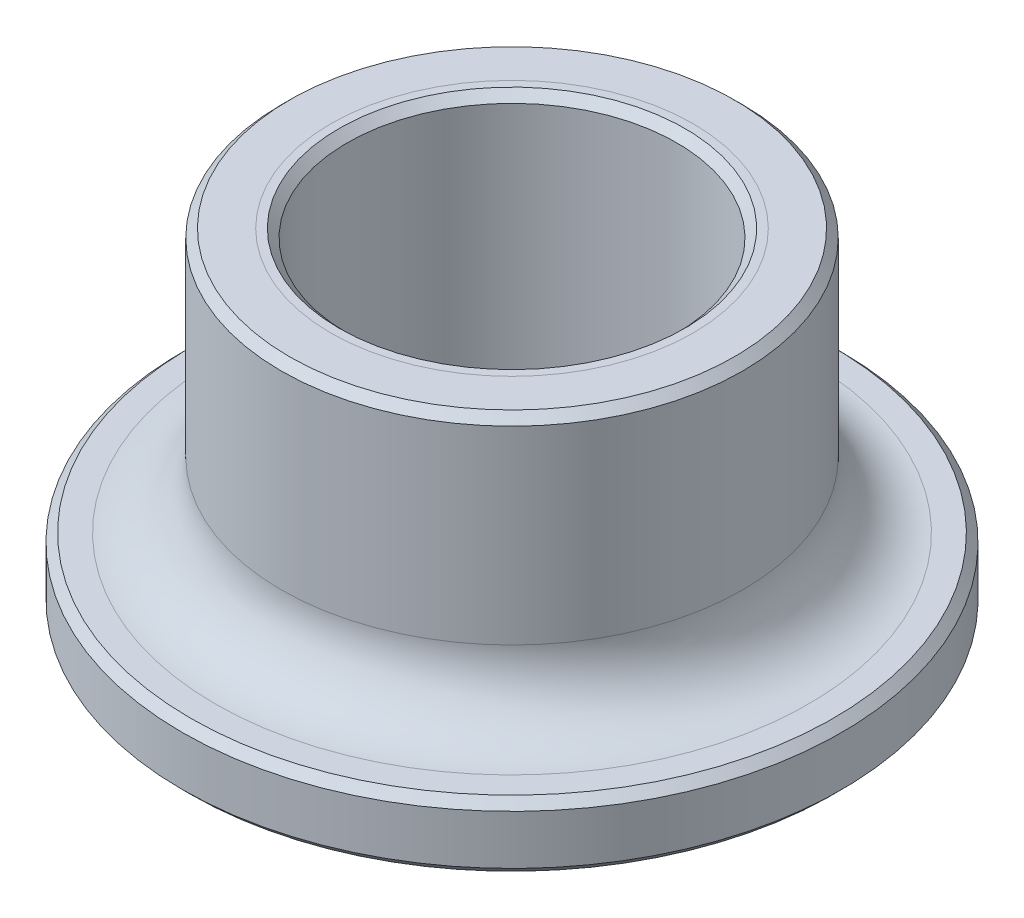
from build123d import *

# Parameters (mm, degrees)
SKETCH1_R           = 10
BOSS_EXTRUDE1_DEPTH = 2
SKETCH2_R           = 7
BOSS_EXTRUDE2_DEPTH = 8
SKETCH3_R           = 5
CUT_EXTRUDE1_DEPTH  = 18.320508076
CHAMFER1_SIZE       = 0.25
FILLET1_R           = 2


with BuildPart() as part:
    # Sketch1 → Boss-Extrude1 (new body)
    with BuildSketch(Plane(origin=(0, 0, 0), x_dir=(1, 0, 0), z_dir=(0, 1, 0))):
        Circle(SKETCH1_R)
    extrude(amount=BOSS_EXTRUDE1_DEPTH)

    # Sketch2 → Boss-Extrude2 (add)
    with BuildSketch(Plane(origin=(0, 2, 0), x_dir=(1, 0, 0), z_dir=(0, 1, 0))):
        Circle(SKETCH2_R)
    extrude(amount=BOSS_EXTRUDE2_DEPTH)

    # Sketch3 → Cut-Extrude1 (cut, through all)
    with BuildSketch(Plane(origin=(0, 10, 0), x_dir=(1, 0, 0), z_dir=(0, 1, 0))):
        Circle(SKETCH3_R)
    extrude(amount=-CUT_EXTRUDE1_DEPTH, mode=Mode.SUBTRACT)

    # Chamfer1
    chamfer1_edges = [part.edges().sort_by_distance(p)[0] for p in [
        (-10, 2, 0),
        (-5, 0, 0),
        (-5, 10, 0),
        (-10, 0, 0),
        (-7, 10, 0),
    ]]
    chamfer(chamfer1_edges, length=CHAMFER1_SIZE)

    # Fillet1
    fillet1_edges = [part.edges().sort_by_distance(p)[0] for p in [
        (-7, 2, 0),
    ]]
    fillet(fillet1_edges, radius=FILLET1_R)


solid = part.part
